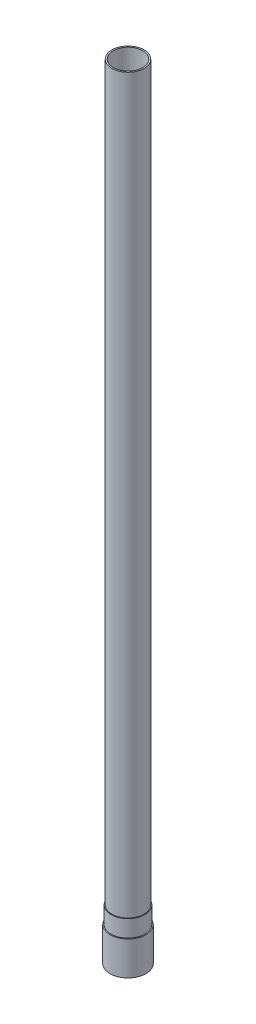
from build123d import *

# Parameters (mm, degrees)
SKETCH1_R           = 15
SKETCH1_R_2         = 13.462
BOSS_EXTRUDE1_DEPTH = 15
SKETCH4_R           = 14.2875
SKETCH4_R_2         = 13.0429
BOSS_EXTRUDE5_DEPTH = 650
BOSS_EXTRUDE6_START = -30
SKETCH1_4_R         = 15.875
SKETCH1_4_R_2       = 13.462
BOSS_EXTRUDE6_DEPTH = 30


with BuildPart() as part:
    # Sketch1 → Boss-Extrude1 (new body)
    with BuildSketch(Plane(origin=(0, 0, 0), x_dir=(1, 0, 0), z_dir=(0, 1, 0))):
        Circle(SKETCH1_R)
        Circle(SKETCH1_R_2, mode=Mode.SUBTRACT)
    extrude(amount=BOSS_EXTRUDE1_DEPTH)

    # Sketch4 → Boss-Extrude5 (add)
    with BuildSketch(Plane(origin=(0, 15, 0), x_dir=(1, 0, 0), z_dir=(0, 1, 0))):
        Circle(SKETCH4_R)
        Circle(SKETCH4_R_2, mode=Mode.SUBTRACT)
    extrude(amount=BOSS_EXTRUDE5_DEPTH)

    # Sketch1<4> → Boss-Extrude6 (add)
    with BuildSketch(Plane(origin=(0, 0, 0), x_dir=(1, 0, 0), z_dir=(0, 1, 0)).offset(BOSS_EXTRUDE6_START)):
        Circle(SKETCH1_4_R)
        Circle(SKETCH1_4_R_2, mode=Mode.SUBTRACT)
    extrude(amount=BOSS_EXTRUDE6_DEPTH)


solid = part.part
